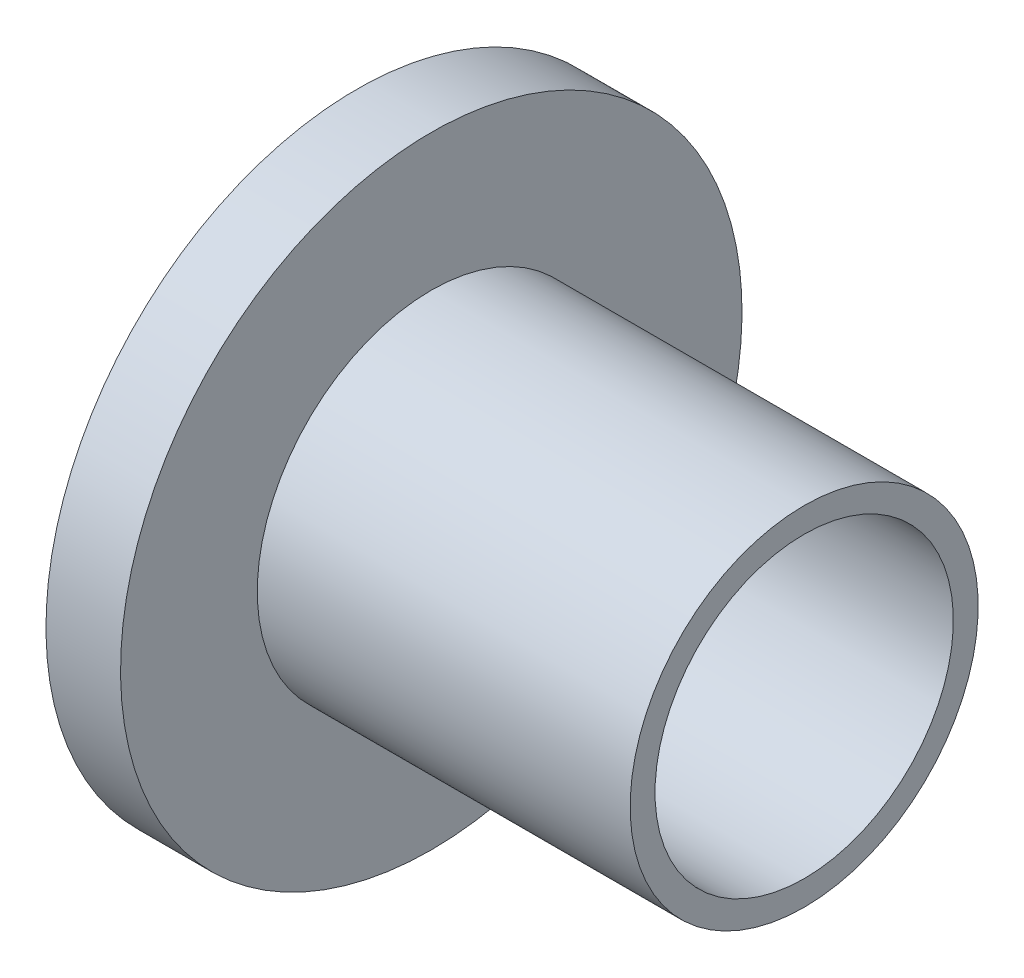
from build123d import *


with BuildPart() as part:
    # Sketch1 → Revolve1 (revolve)
    with BuildSketch(Plane.XY):
        Polygon((-6, 25), (-6, 10), (0, 10), (0, 12), (30, 12), (30, 14), (0, 14), (0, 25), align=None)
    revolve(axis=Axis((-64.900117457, 0, 0), (1, 0, 0)))


solid = part.part
